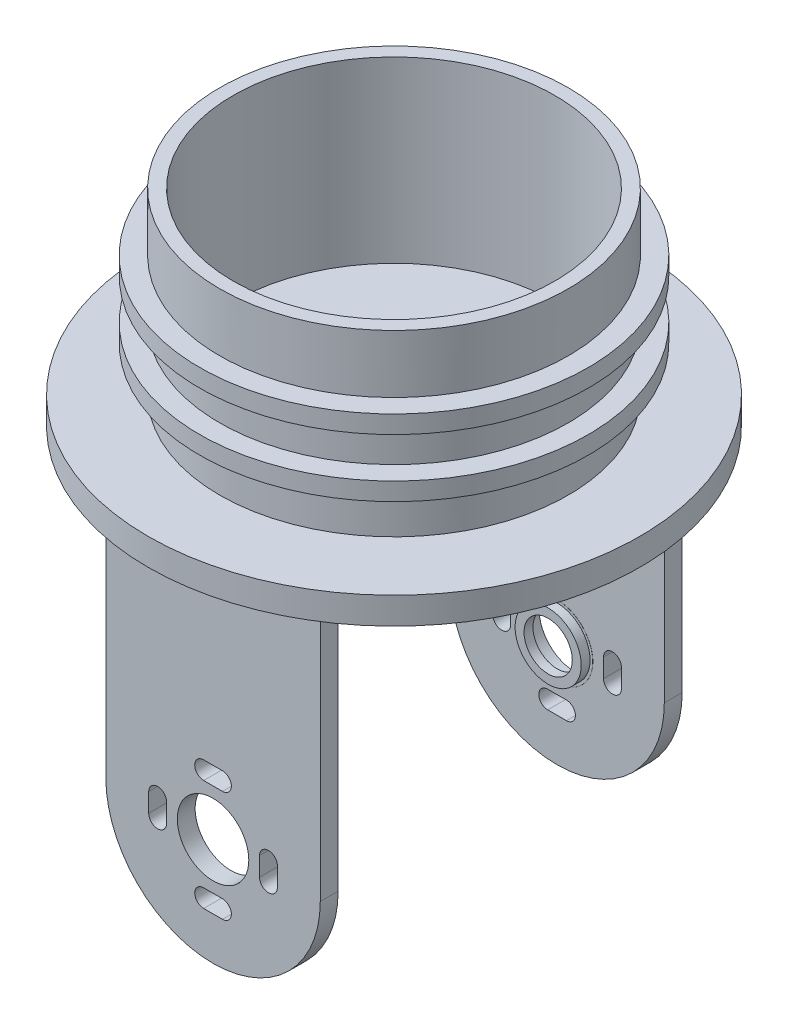
from build123d import *

# Parameters (mm, degrees)
SKETCH_1_R               = 19.5
SKETCH_1_R_2             = 18
EXTRUDE_1_DEPTH          = 20
SKETCH_3_R               = 27.5
EXTRUDE_2_DEPTH          = 3
EXTRUDE_START            = 2
SKETCH_25_R              = 21.75
SKETCH_25_R_2            = 19.5
EXTRUDE_12_DEPTH         = 2
EXTRUDE_START_2          = -1
SKETCH_26_R              = 21.75
SKETCH_26_R_2            = 19.5
EXTRUDE_13_DEPTH         = 2
SKETCH_28_R              = 4
EXTRUDE_14_DEPTH         = 2
PATTERN_LINEAR_1_COUNT   = 2
PATTERN_LINEAR_1_PITCH   = 38.5
SKETCH_30_W              = 11
SKETCH_30_H              = 7
EXTRUDE_16_DEPTH         = 10
CUT_EXTRUDE_2_DEPTH      = 10
CUT_EXTRUDE_2_DEPTH_BACK = 10
SKETCH_29_W              = 9
SKETCH_29_H              = 5
SKETCH_31_R              = 3.7
SKETCH_31_R_2            = 2.7
EXTRUDE_17_DEPTH         = 1
EXTRUDE_START_3          = 0.01
SKETCH_32_R              = 4
SKETCH_32_R_2            = 3.7
EXTRUDE_18_DEPTH         = 0.01


with BuildPart() as part:
    # 草圖1 → 填料-伸長1 (new body)
    with BuildSketch(Plane(origin=(0, 0, 0), x_dir=(1, 0, 0), z_dir=(0, 1, 0))):
        Circle(SKETCH_1_R)
        Circle(SKETCH_1_R_2, mode=Mode.SUBTRACT)
    extrude(amount=EXTRUDE_1_DEPTH)

    # 草圖3 → 填料-伸長2 (add)
    with BuildSketch(Plane.XZ):
        Circle(SKETCH_3_R)
    extrude(amount=EXTRUDE_2_DEPTH)

    # 草圖25 → 填料-伸長12 (add)
    with BuildSketch(Plane(origin=(0, 7, 0), x_dir=(-1, 0, 0), z_dir=(0, -1, 0)).offset(EXTRUDE_START)):
        Circle(SKETCH_25_R)
        Circle(SKETCH_25_R_2, mode=Mode.SUBTRACT)
    extrude(amount=-EXTRUDE_12_DEPTH)

    # 草圖26 → 填料-伸長13 (add)
    with BuildSketch(Plane(origin=(0, 10.5, 0), x_dir=(-1, 0, 0), z_dir=(0, -1, 0)).offset(EXTRUDE_START_2)):
        Circle(SKETCH_26_R)
        Circle(SKETCH_26_R_2, mode=Mode.SUBTRACT)
    extrude(amount=-EXTRUDE_13_DEPTH)

    # 草圖28 → 填料-伸長14 (add)
    with BuildSketch(Plane.XY.offset(-18.25)):
        with BuildLine():
            Line((-12, -3), (12, -3))
            Line((12, -3), (12, -33))
            ThreePointArc((12, -33), (0, -45), (-12, -33))
            Line((-12, -33), (-12, -3))
        make_face()
        with Locations((0, -33)):
            Circle(SKETCH_28_R, mode=Mode.SUBTRACT)
        with BuildLine():
            Line((-1.05, -25.8), (1.05, -25.8))
            ThreePointArc((1.05, -25.8), (2.05, -26.8), (1.05, -27.8))
            Line((1.05, -27.8), (-1.05, -27.8))
            ThreePointArc((-1.05, -27.8), (-2.05, -26.8), (-1.05, -25.8))
        make_face(mode=Mode.SUBTRACT)
        with BuildLine():
            Line((7.2, -31.95), (7.2, -34.05))
            ThreePointArc((7.2, -34.05), (6.2, -35.05), (5.2, -34.05))
            Line((5.2, -34.05), (5.2, -31.95))
            ThreePointArc((5.2, -31.95), (6.2, -30.95), (7.2, -31.95))
        make_face(mode=Mode.SUBTRACT)
        with BuildLine():
            Line((-1.05, -40.2), (1.05, -40.2))
            ThreePointArc((1.05, -40.2), (2.05, -39.2), (1.05, -38.2))
            Line((1.05, -38.2), (-1.05, -38.2))
            ThreePointArc((-1.05, -38.2), (-2.05, -39.2), (-1.05, -40.2))
        make_face(mode=Mode.SUBTRACT)
        with BuildLine():
            Line((-7.2, -31.95), (-7.2, -34.05))
            ThreePointArc((-7.2, -34.05), (-6.2, -35.05), (-5.2, -34.05))
            Line((-5.2, -34.05), (-5.2, -31.95))
            ThreePointArc((-5.2, -31.95), (-6.2, -30.95), (-7.2, -31.95))
        make_face(mode=Mode.SUBTRACT)
    extrude_14 = extrude(amount=-EXTRUDE_14_DEPTH)

    # 直線複製排列1: 填料-伸長14 ×2
    with Locations(*[(0, 0, i * PATTERN_LINEAR_1_PITCH) for i in range(1, PATTERN_LINEAR_1_COUNT)]):
        add(extrude_14)

    # 草圖30 → 填料-伸長16 (add)
    with BuildSketch(Plane(origin=(0, 0, 0), x_dir=(1, 0, 0), z_dir=(0, 1, 0))):
        with Locations((0, -12.44566721)):
            Rectangle(SKETCH_30_W, SKETCH_30_H)
    extrude(amount=EXTRUDE_16_DEPTH)

    # 草圖29 → 除料-伸長2 (cut, two sides: drawn at the far end of the back side and taken through both)
    with BuildSketch(Plane(origin=(0, 0, 0), x_dir=(1, 0, 0), z_dir=(0, 1, 0)).offset(-CUT_EXTRUDE_2_DEPTH_BACK)):
        with Locations((0, -12.44566721)):
            Rectangle(SKETCH_29_W, SKETCH_29_H)
    extrude(amount=CUT_EXTRUDE_2_DEPTH + CUT_EXTRUDE_2_DEPTH_BACK, mode=Mode.SUBTRACT)


with BuildPart() as body_2:
    # 草圖31 → 填料-伸長17 (new body)
    with BuildSketch(Plane.XY.offset(-18.25)):
        with Locations((0, -33)):
            Circle(SKETCH_31_R)
        with Locations((0, -33)):
            Circle(SKETCH_31_R_2, mode=Mode.SUBTRACT)
    extrude(amount=EXTRUDE_17_DEPTH)

    # 草圖32 → 填料-伸長18 (add)
    with BuildSketch(Plane.XY.offset(-18.25).offset(EXTRUDE_START_3)):
        with Locations((0, -33)):
            Circle(SKETCH_32_R)
        with Locations((0, -33)):
            Circle(SKETCH_32_R_2, mode=Mode.SUBTRACT)
    extrude(amount=-EXTRUDE_18_DEPTH)


solid = Compound([part.part, body_2.part])
